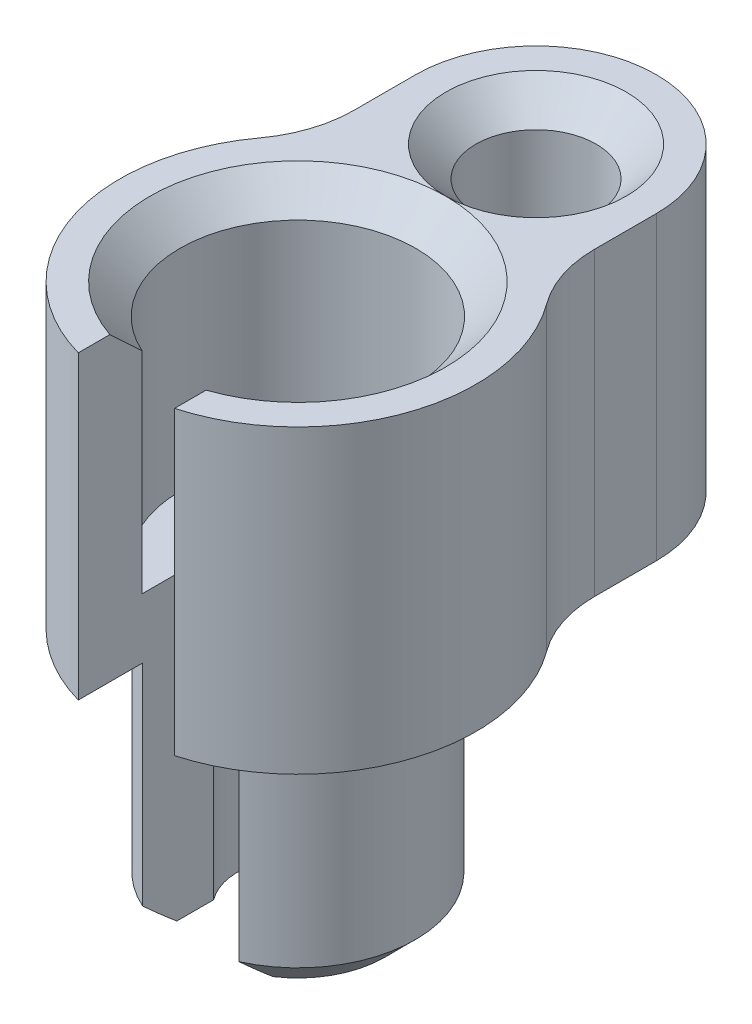
from build123d import *

# Parameters (mm, degrees)
SKETCH2_W           = 2.54
SKETCH2_H           = 14.2875
CUT_EXTRUDE1_DEPTH  = 16.757342995
SKETCH3_W           = 1.5875
SKETCH3_H           = 7.9375
SKETCH3_W_2         = 4.7625
SKETCH3_H_2         = 4.7625
BOSS_EXTRUDE2_DEPTH = 3.175
SKETCH4_R           = 1.5875
CUT_EXTRUDE2_DEPTH  = 18.768884025
CHAMFER2_SIZE       = 0.79375
FILLET3_R           = 3.175


with BuildPart() as part:
    # Sketch1 → Revolve1 (revolve)
    with BuildSketch(Plane.XY, mode=Mode.PRIVATE) as revolve1_sk:
        Polygon((1.5875, 7.9375), (1.5875, 0), (3.0988, 0), (3.0988, 6.35), (4.699, 6.35), (4.699, 14.2875), (3.1115, 14.2875), (3.1115, 7.9375), align=None)
    revolve(revolve1_sk.sketch.rotate(Axis((0, 0.120875177, 0), (0, -1, 0)), 180), axis=Axis((0, 0.120875177, 0), (0, -1, 0)))

    # Sketch2 → Cut-Extrude1 (cut, through all)
    with BuildSketch(Plane.XY):
        with Locations((0, 7.14375)):
            Rectangle(SKETCH2_W, SKETCH2_H)
    extrude(amount=CUT_EXTRUDE1_DEPTH, mode=Mode.SUBTRACT)

    # Sketch3 → Boss-Extrude2 (add, symmetric)
    # profile 1 of 3: a face of its own
    with BuildSketch(Plane(origin=(0, 0, 0), x_dir=(0, 0, -1), z_dir=(1, 0, 0))):
        with Locations((3.90525, 10.31875)):
            Rectangle(SKETCH3_W, SKETCH3_H)
    # profile 2 of 3: a face of its own
    with BuildSketch(Plane(origin=(0, 0, 0), x_dir=(0, 0, -1), z_dir=(1, 0, 0))):
        with Locations((7.08025, 10.31875)):
            Rectangle(SKETCH3_W_2, SKETCH3_H)
        with Locations((7.08025, 10.31875)):
            Rectangle(SKETCH3_W, SKETCH3_H_2, mode=Mode.SUBTRACT)
    # profile 3 of 3: a face of its own
    with BuildSketch(Plane(origin=(0, 0, 0), x_dir=(0, 0, -1), z_dir=(1, 0, 0))):
        with Locations((7.08025, 10.31875)):
            Rectangle(SKETCH3_W, SKETCH3_H_2)
    extrude(amount=BOSS_EXTRUDE2_DEPTH, both=True)

    # Sketch4 → Cut-Extrude2 (cut, through all)
    with BuildSketch(Plane(origin=(0, 14.2875, 0), x_dir=(1, 0, 0), z_dir=(0, 1, 0))):
        with Locations(Location((0, 6.2865, 0), (0, 0, 180))):
            Circle(SKETCH4_R)
    extrude(amount=-CUT_EXTRUDE2_DEPTH, mode=Mode.SUBTRACT)

    # Chamfer2
    chamfer2_edges = [part.edges().sort_by_distance(p)[0] for p in [
        (0, 14.2875, -3.1115),
        (0, 0, -3.0988),
        (1.5875, 6.35, -6.2865),
        (1.5875, 14.2875, -6.2865),
    ]]
    chamfer(chamfer2_edges, length=CHAMFER2_SIZE - 0.0001)  # a hair under: the kernel refuses the full size

    # Fillet3
    fillet3_edges = [part.edges().sort_by_distance(p)[0] for p in [
        (3.175, 10.31875, -3.464098151),
        (-3.175, 10.31875, -3.464098151),
        (-3.175, 10.31875, -9.4615),
        (3.175, 10.31875, -9.4615),
    ]]
    fillet(fillet3_edges, radius=FILLET3_R - 0.0001)  # a hair under: the kernel refuses the full size


solid = part.part
